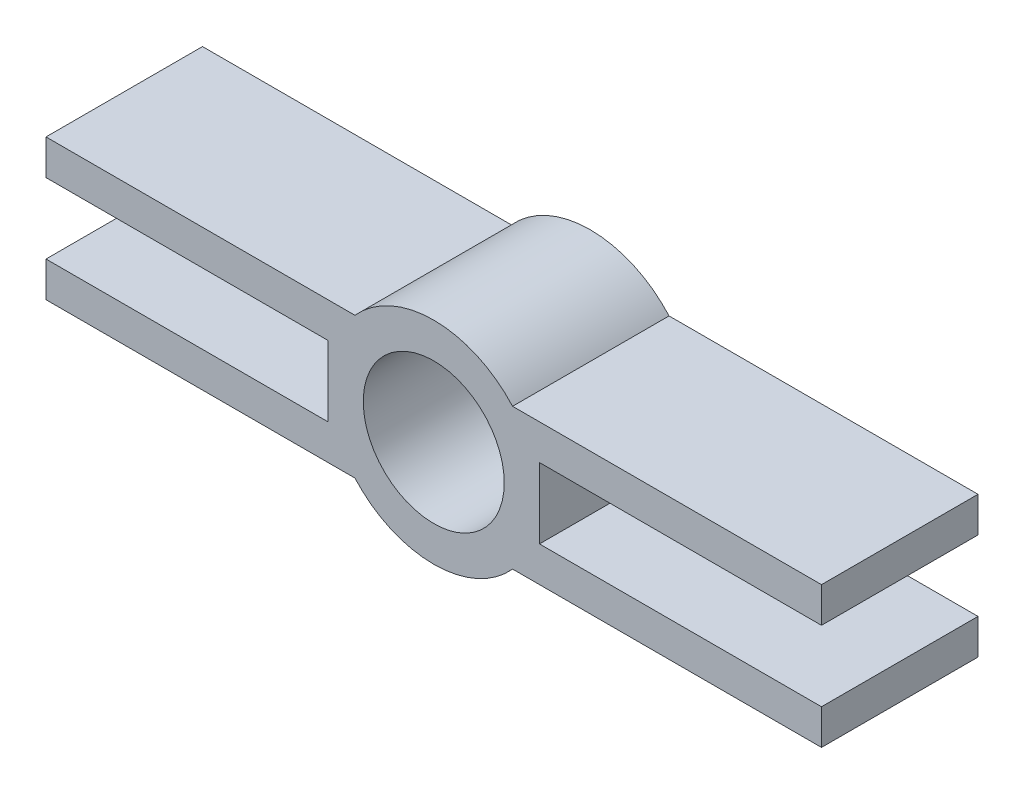
from build123d import *

# Parameters (mm, degrees)
SKETCH1_R           = 12.7
BOSS_EXTRUDE1_DEPTH = 28.194


with BuildPart() as part:
    # Sketch1 → Boss-Extrude1 (new body)
    with BuildSketch(Plane.XY):
        with BuildLine():
            Line((4.850968343, 0), (-50.8, 0))
            Line((-50.8, 0), (-50.8, 6.35))
            Line((-50.8, 6.35), (0, 6.35))
            Line((0, 6.35), (0, 19.05))
            Line((0, 19.05), (-50.8, 19.05))
            Line((-50.8, 19.05), (-50.8, 25.4))
            Line((-50.8, 25.4), (4.850968343, 25.4))
            ThreePointArc((4.850968343, 25.4), (19.05, 31.75), (33.249031657, 25.4))
            Line((33.249031657, 25.4), (88.9, 25.4))
            Line((88.9, 25.4), (88.9, 19.05))
            Line((88.9, 19.05), (38.1, 19.05))
            Line((38.1, 19.05), (38.1, 6.35))
            Line((38.1, 6.35), (88.9, 6.35))
            Line((88.9, 6.35), (88.9, 0))
            Line((88.9, 0), (33.249031657, 0))
            ThreePointArc((33.249031657, 0), (19.05, -6.35), (4.850968343, 0))
        make_face()
        with Locations((19.05, 12.7)):
            Circle(SKETCH1_R, mode=Mode.SUBTRACT)
    extrude(amount=BOSS_EXTRUDE1_DEPTH)


solid = part.part
